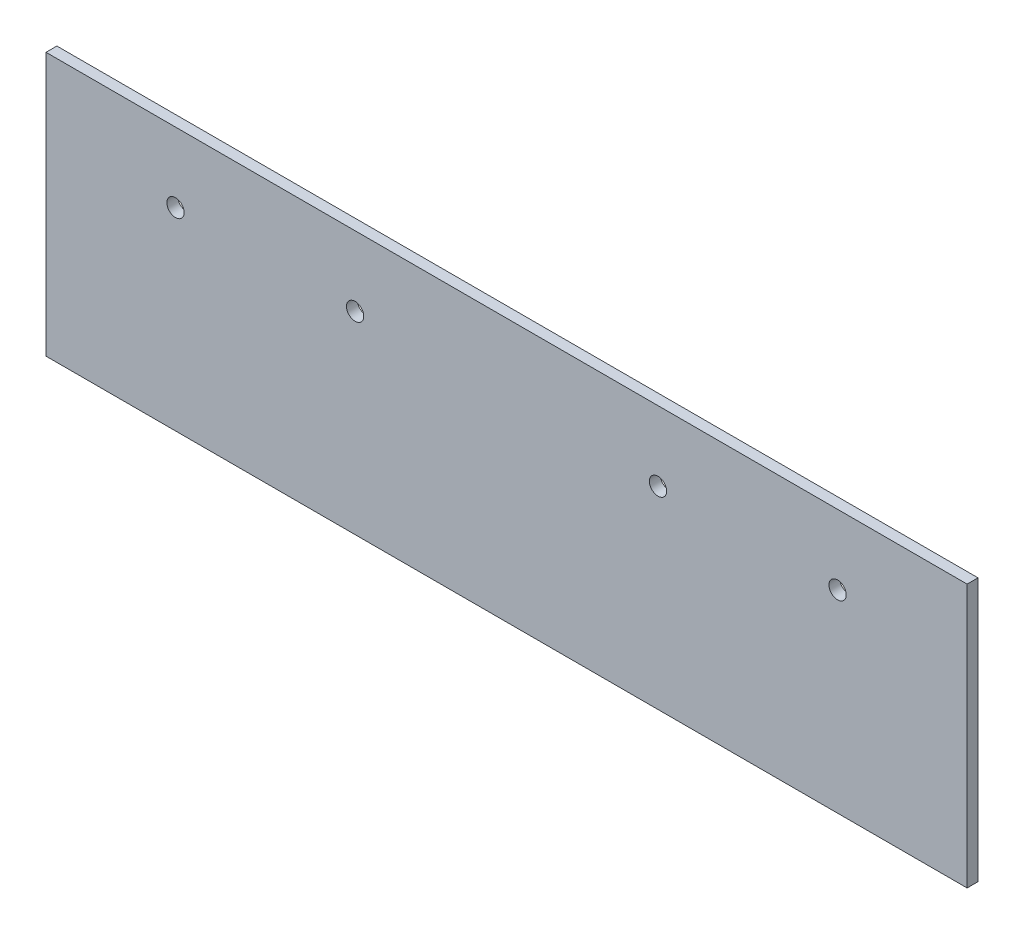
from build123d import *

# Parameters (mm, degrees)
SKETCH1_W             = 133.35
SKETCH1_H             = 38.1
BOSS_EXTRUDE1_DEPTH   = 1.5748
F_2_5MM_DOWEL_HOLE1_D = 2.5


with BuildPart() as part:
    # Sketch1 → Boss-Extrude1 (new body)
    with BuildSketch(Plane.XY):
        Rectangle(SKETCH1_W, SKETCH1_H)
    extrude(amount=BOSS_EXTRUDE1_DEPTH)

    # Ø2.5mm Dowel Hole1 (through all)
    with Locations(Plane.XY.offset(1.5748)):
        with Locations((-47.925, 8.95), (-21.925, 8.95), (21.925, 8.95), (47.925, 8.95)):
            Hole(F_2_5MM_DOWEL_HOLE1_D / 2)


solid = part.part
